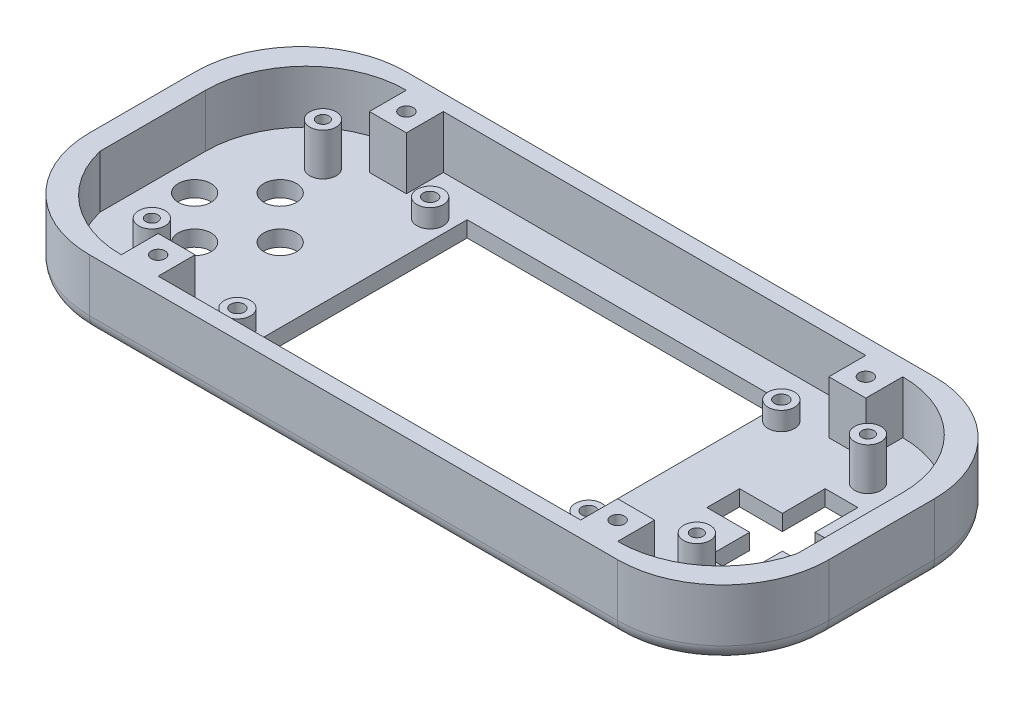
from build123d import *

# Parameters (mm, degrees)
BOSS_EXTRUDE1_DEPTH = 3
BOSS_EXTRUDE2_DEPTH = 10
SKETCH3_W           = 60
SKETCH3_H           = 43
CUT_EXTRUDE1_DEPTH  = 5
SKETCH4_R           = 2.5
BOSS_EXTRUDE3_DEPTH = 3.5
SKETCH5_R           = 1.3
CUT_EXTRUDE2_DEPTH  = 4.5
SKETCH6_R           = 1.3
CUT_EXTRUDE3_DEPTH  = 4.5
SKETCH7_R           = 1.3
CUT_EXTRUDE4_DEPTH  = 4.5
SKETCH8_R           = 1.3
CUT_EXTRUDE5_DEPTH  = 4.5
SKETCH9_R           = 3.1
CUT_EXTRUDE6_DEPTH  = 4.5
SKETCH10_R          = 2.5
SKETCH10_R_2        = 1.15
BOSS_EXTRUDE4_DEPTH = 8
SKETCH12_W          = 7
SKETCH12_H          = 7
BOSS_EXTRUDE5_DEPTH = 10
FILLET1_R           = 3
SKETCH13_R          = 1.3
CUT_EXTRUDE7_DEPTH  = 9


with BuildPart() as part:
    # Sketch1 → Boss-Extrude1 (new body)
    with BuildSketch(Plane(origin=(0, 0, 0), x_dir=(1, 0, 0), z_dir=(0, 1, 0))):
        with BuildLine():
            Line((70, 10), (70, -10))
            ThreePointArc((70, -10), (64.142135624, -24.142135624), (50, -30))
            Line((50, -30), (-50, -30))
            ThreePointArc((-50, -30), (-64.142135624, -24.142135624), (-70, -10))
            Line((-70, -10), (-70, 10))
            ThreePointArc((-70, 10), (-64.142135624, 24.142135624), (-50, 30))
            Line((-50, 30), (50, 30))
            ThreePointArc((50, 30), (64.142135624, 24.142135624), (70, 10))
        make_face()
    extrude(amount=BOSS_EXTRUDE1_DEPTH)

    # Sketch2 → Boss-Extrude2 (add)
    with BuildSketch(Plane(origin=(0, 3, 0), x_dir=(1, 0, 0), z_dir=(0, 1, 0))):
        with BuildLine():
            Line((50, 30), (-50, 30))
            ThreePointArc((-50, 30), (-64.142135624, 24.142135624), (-70, 10))
            Line((-70, 10), (-70, -10))
            ThreePointArc((-70, -10), (-64.142135624, -24.142135624), (-50, -30))
            Line((-50, -30), (50, -30))
            ThreePointArc((50, -30), (64.142135624, -24.142135624), (70, -10))
            Line((70, -10), (70, 10))
            ThreePointArc((70, 10), (64.142135624, 24.142135624), (50, 30))
        make_face()
        with BuildLine():
            ThreePointArc((-66, 8), (-60.435028843, 21.435028843), (-47, 27))
            Line((-47, 27), (47, 27))
            ThreePointArc((47, 27), (60.435028843, 21.435028843), (66, 8))
            Line((66, 8), (66, -12))
            ThreePointArc((66, -12), (59.103718437, -22.798043353), (47, -27))
            Line((47, -27), (-47, -27))
            ThreePointArc((-47, -27), (-59.103718437, -22.798043353), (-66, -12))
            Line((-66, -12), (-66, 8))
        make_face(mode=Mode.SUBTRACT)
    extrude(amount=BOSS_EXTRUDE2_DEPTH)

    # Sketch3 → Cut-Extrude1 (cut)
    with BuildSketch(Plane(origin=(0, 3, 0), x_dir=(1, 0, 0), z_dir=(0, 1, 0))):
        Rectangle(SKETCH3_W, SKETCH3_H)
    extrude(amount=-CUT_EXTRUDE1_DEPTH, mode=Mode.SUBTRACT)

    # Sketch4 → Boss-Extrude3 (add)
    with BuildSketch(Plane(origin=(0, 3, 0), x_dir=(1, 0, 0), z_dir=(0, 1, 0))):
        with Locations((-33.75, 18.25)):
            Circle(SKETCH4_R)
        with Locations((-33.75, -18.25)):
            Circle(SKETCH4_R)
        with Locations((32.75, -18.25)):
            Circle(SKETCH4_R)
        with Locations((32.75, 18.25)):
            Circle(SKETCH4_R)
    extrude(amount=BOSS_EXTRUDE3_DEPTH)

    # Sketch5 → Cut-Extrude2 (cut)
    with BuildSketch(Plane(origin=(0, 6.5, 0), x_dir=(1, 0, 0), z_dir=(0, 1, 0))):
        with Locations((-33.75, -18.25)):
            Circle(SKETCH5_R)
    extrude(amount=-CUT_EXTRUDE2_DEPTH, mode=Mode.SUBTRACT)

    # Sketch6 → Cut-Extrude3 (cut)
    with BuildSketch(Plane(origin=(0, 6.5, 0), x_dir=(1, 0, 0), z_dir=(0, 1, 0))):
        with Locations((-33.75, 18.25)):
            Circle(SKETCH6_R)
    extrude(amount=-CUT_EXTRUDE3_DEPTH, mode=Mode.SUBTRACT)

    # Sketch7 → Cut-Extrude4 (cut)
    with BuildSketch(Plane(origin=(0, 6.5, 0), x_dir=(1, 0, 0), z_dir=(0, 1, 0))):
        with Locations((32.75, 18.25)):
            Circle(SKETCH7_R)
    extrude(amount=-CUT_EXTRUDE4_DEPTH, mode=Mode.SUBTRACT)

    # Sketch8 → Cut-Extrude5 (cut)
    with BuildSketch(Plane(origin=(0, 6.5, 0), x_dir=(1, 0, 0), z_dir=(0, 1, 0))):
        with Locations((32.75, -18.25)):
            Circle(SKETCH8_R)
    extrude(amount=-CUT_EXTRUDE5_DEPTH, mode=Mode.SUBTRACT)

    # Sketch9 → Cut-Extrude6 (cut)
    with BuildSketch(Plane(origin=(0, 3, 0), x_dir=(1, 0, 0), z_dir=(0, 1, 0))):
        with Locations((-44, 0.1)):
            Circle(SKETCH9_R)
        with Locations((-52.1, 8.2)):
            Circle(SKETCH9_R)
        with Locations((-60.2, 0.1)):
            Circle(SKETCH9_R)
        with Locations((-52.1, -8)):
            Circle(SKETCH9_R)
        Polygon((62.3, 3.2), (54.2, 3.2), (54.2, 5.1), (54.2, 11.3), (48, 11.3), (48, 5.1), (48, 3.2), (46.1, 3.2), (39.9, 3.2), (39.9, -3), (46.1, -3), (48, -3), (48, -4.9), (48, -11.1), (54.2, -11.1), (54.2, -4.9), (54.2, -3), (62.3, -3), align=None)
    extrude(amount=-CUT_EXTRUDE6_DEPTH, mode=Mode.SUBTRACT)

    # Sketch10 → Boss-Extrude4 (add)
    # profile 1 of 4: a face of its own
    with BuildSketch(Plane(origin=(0, 3, 0), x_dir=(1, 0, 0), z_dir=(0, 1, 0))):
        with Locations((-52.1, -16.1)):
            Circle(SKETCH10_R)
        with Locations((-52.1, -16.1)):
            Circle(SKETCH10_R_2, mode=Mode.SUBTRACT)
    # profile 2 of 4: a face of its own
    with BuildSketch(Plane(origin=(0, 3, 0), x_dir=(1, 0, 0), z_dir=(0, 1, 0))):
        with Locations((-52.1, 16.3)):
            Circle(SKETCH10_R)
        with Locations((-52.1, 16.3)):
            Circle(SKETCH10_R_2, mode=Mode.SUBTRACT)
    # profile 3 of 4: a face of its own
    with BuildSketch(Plane(origin=(0, 3, 0), x_dir=(1, 0, 0), z_dir=(0, 1, 0))):
        with Locations((51.1, 16.3)):
            Circle(SKETCH10_R)
        with Locations((51.1, 16.3)):
            Circle(SKETCH10_R_2, mode=Mode.SUBTRACT)
    # profile 4 of 4: a face of its own
    with BuildSketch(Plane(origin=(0, 3, 0), x_dir=(1, 0, 0), z_dir=(0, 1, 0))):
        with Locations((51.1, -16.1)):
            Circle(SKETCH10_R)
        with Locations((51.1, -16.1)):
            Circle(SKETCH10_R_2, mode=Mode.SUBTRACT)
    extrude(amount=BOSS_EXTRUDE4_DEPTH)

    # Sketch12 → Boss-Extrude5 (add)
    with BuildSketch(Plane(origin=(0, 3, 0), x_dir=(1, 0, 0), z_dir=(0, 1, 0))):
        with Locations((-43.5, 23.5)):
            Rectangle(SKETCH12_W, SKETCH12_H)
        with Locations((-43.5, -23.5)):
            Rectangle(SKETCH12_W, SKETCH12_H)
        with Locations((43.5, -23.5)):
            Rectangle(SKETCH12_W, SKETCH12_H)
        with Locations((43.5, 23.5)):
            Rectangle(SKETCH12_W, SKETCH12_H)
    extrude(amount=BOSS_EXTRUDE5_DEPTH)

    # Fillet1
    fillet1_edges = [part.edges().sort_by_distance(p)[0] for p in [
        (-64.142135624, 0, 24.142135624),
        (-64.142135624, 0, -24.142135624),
        (-70, 0, 0),
        (0, 0, 30),
        (64.142135624, 0, 24.142135624),
        (70, 0, 0),
        (64.142135624, 0, -24.142135624),
        (0, 0, -30),
    ]]
    fillet(fillet1_edges, radius=FILLET1_R)

    # Sketch13 → Cut-Extrude7 (cut)
    with BuildSketch(Plane(origin=(0, 13, 0), x_dir=(1, 0, 0), z_dir=(0, 1, 0))):
        with Locations((-43.5, 23.5)):
            Circle(SKETCH13_R)
        with Locations((-43.5, -23.5)):
            Circle(SKETCH13_R)
        with Locations((43.5, -23.5)):
            Circle(SKETCH13_R)
        with Locations((43.5, 23.5)):
            Circle(SKETCH13_R)
    extrude(amount=-CUT_EXTRUDE7_DEPTH, mode=Mode.SUBTRACT)


solid = part.part
